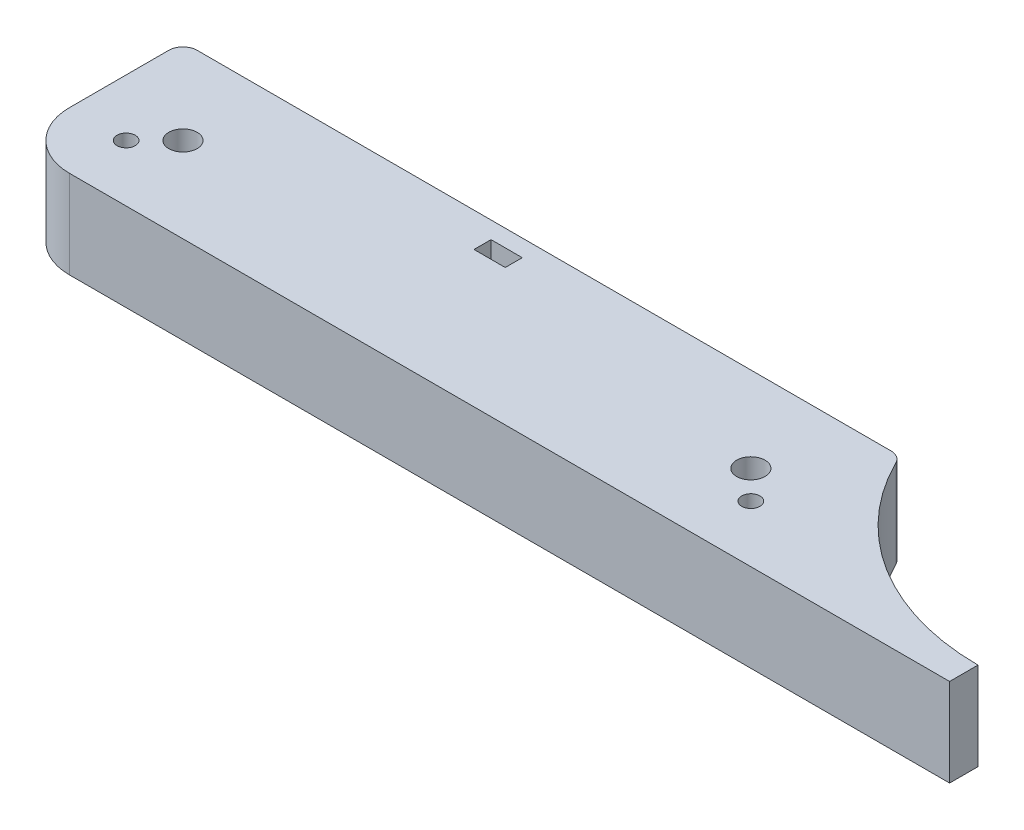
from build123d import *
from OCP.BRepFilletAPI import BRepFilletAPI_MakeChamfer, BRepFilletAPI_MakeFillet

# Parameters (mm, degrees)
BOSS_EXTRU_1_DEPTH      = 15.5
BOSS_EXTRU_2_START      = -35
BOSS_EXTRU_2_DEPTH      = 30
CHANFREIN1_SIZE         = 3.2
CHANFREIN2_SIZE         = 1.2
CHANFREIN2_SIZE2        = 1.697056275
CONG_1_R1               = 10
CONG_1_R2               = 2.5
ENL_V_MAT_EXTRU_1_REACH = 174.399
ESQUISSE3_R             = 1.6
ESQUISSE4_R             = 2
ENL_V_MAT_EXTRU_2_DEPTH = 13
ESQUISSE9_R             = 2.5
ENL_V_MAT_EXTRU_7_DEPTH = 7
ENL_V_MAT_EXTRU_3_REACH = 174.399
ESQUISSE5_R             = 1.6
ESQUISSE6_R             = 2
ENL_V_MAT_EXTRU_4_DEPTH = 13
ESQUISSE10_R            = 2.5
ENL_V_MAT_EXTRU_8_DEPTH = 7
ESQUISSE7_R             = 1.6
ENL_V_MAT_EXTRU_5_DEPTH = 12
ENL_V_START             = -3
ENL_V_MAT_EXTRU_6_DEPTH = 3


with BuildPart() as part:
    # Esquisse1 → Boss.-Extru.1 (new body)
    with BuildSketch(Plane(origin=(0, 0, 0), x_dir=(1, 0, 0), z_dir=(0, 1, 0))):
        with BuildLine():
            ThreePointArc((0, -42.5), (-23.048861143, -35.707142143), (-38.729833462, -17.5))
            Line((-38.729833462, -17.5), (-165, -17.5))
            Line((-165, -17.5), (-165, -47.5))
            Line((-165, -47.5), (0, -47.5))
            Line((0, -47.5), (0, -42.5))
        make_face()
    extrude(amount=BOSS_EXTRU_1_DEPTH)

    # Esquisse11 → Boss.-Extru.2 (add)
    with BuildSketch(Plane.ZY.offset(165).offset(BOSS_EXTRU_2_START)):
        Polygon((17.5, 0), (14.4, 0), (14.4, 6), (16, 6), (16, 2), (17.5, 2), align=None)
    extrude(amount=-BOSS_EXTRU_2_DEPTH)

    # Chanfrein1
    # the kernel refuses this chamfer: 3.2 mm, written as the material it adds along each edge
    with BuildSketch(Plane(origin=(-100, 10.229385561, 17.5), x_dir=(0.9996219169112968, 0, 0.027495876610586226), z_dir=(0, -1, 0))) as chanfrein1_piece_1_section:
        Polygon((CHANFREIN1_SIZE * 0.999621916911, -CHANFREIN1_SIZE * 0.0274958766106), (-CHANFREIN1_SIZE * 0.0274958766106, -CHANFREIN1_SIZE * 0.999621916911), (0, 0), align=None)
    chanfrein1_piece_1 = extrude(amount=10.229385561, mode=Mode.PRIVATE)
    chanfrein1_piece_1 = split(chanfrein1_piece_1, bisect_by=Plane(origin=(-99.489179746, 2, 15.404286374), z_dir=(0, 1, 0)), keep=Keep.TOP, mode=Mode.PRIVATE)
    chanfrein1_piece_1 = split(chanfrein1_piece_1, bisect_by=Plane(origin=(-99.489179746, 4, 14.4), z_dir=(0, 0, 1)), keep=Keep.TOP, mode=Mode.PRIVATE)
    chanfrein1_piece_1 = split(chanfrein1_piece_1, bisect_by=Plane(origin=(-99.489179746, 6, 15.404286374), z_dir=(0, -1, 0)), keep=Keep.TOP, mode=Mode.PRIVATE)
    chanfrein1_piece_1 = split(chanfrein1_piece_1, bisect_by=Plane(origin=(-99.489179746, 4, 16), z_dir=(0, 0, -1)), keep=Keep.TOP, mode=Mode.PRIVATE)
    add(chanfrein1_piece_1)
    with BuildSketch(Plane(origin=(-100, 2, 17.5), x_dir=(0.9996219169112968, 0, 0.027495876610585147), z_dir=(0, -1, 0))) as chanfrein1_piece_2_section:
        Polygon((CHANFREIN1_SIZE * 0.999621916911, -CHANFREIN1_SIZE * 0.0274958766106), (-CHANFREIN1_SIZE * 0.0274958766106, -CHANFREIN1_SIZE * 0.999621916911), (0, 0), align=None)
    chanfrein1_piece_2 = extrude(amount=2, mode=Mode.PRIVATE)
    chanfrein1_piece_2 = split(chanfrein1_piece_2, bisect_by=Plane(origin=(-98.721329155, 1, 16), z_dir=(0, 0, 1)), keep=Keep.TOP, mode=Mode.PRIVATE)
    add(chanfrein1_piece_2)
    with BuildSketch(Plane(origin=(-100, 2, 17.5), x_dir=(0.9996219169112968, 0, 0.027495876610585147), z_dir=(0, -1, 0))) as chanfrein1_piece_3_section:
        Polygon((CHANFREIN1_SIZE * 0.999621916911, -CHANFREIN1_SIZE * 0.0274958766106), (-CHANFREIN1_SIZE * 0.0274958766106, -CHANFREIN1_SIZE * 0.999621916911), (0, 0), align=None)
    chanfrein1_piece_3 = extrude(amount=2, mode=Mode.PRIVATE)
    chanfrein1_piece_3 = split(chanfrein1_piece_3, bisect_by=Plane(origin=(-99.489179746, 1, 14.4), z_dir=(0, 0, 1)), keep=Keep.TOP, mode=Mode.PRIVATE)
    chanfrein1_piece_3 = split(chanfrein1_piece_3, bisect_by=Plane(origin=(-99.489179746, 1, 16), z_dir=(0, 0, -1)), keep=Keep.TOP, mode=Mode.PRIVATE)
    add(chanfrein1_piece_3)
    with BuildSketch(Plane(origin=(-130, 10.229385561, 17.5), x_dir=(-0.9996219169112966, 0, 0.02749587661058634), z_dir=(0, -1, 0))) as chanfrein1_piece_4_section:
        Polygon((CHANFREIN1_SIZE * 0.999621916911, CHANFREIN1_SIZE * 0.0274958766106), (-CHANFREIN1_SIZE * 0.0274958766106, CHANFREIN1_SIZE * 0.999621916911), (0, 0), align=None)
    chanfrein1_piece_4 = extrude(amount=10.229385561, mode=Mode.PRIVATE)
    chanfrein1_piece_4 = split(chanfrein1_piece_4, bisect_by=Plane(origin=(-130.510820254, 2, 15.404286374), z_dir=(0, 1, 0)), keep=Keep.TOP, mode=Mode.PRIVATE)
    chanfrein1_piece_4 = split(chanfrein1_piece_4, bisect_by=Plane(origin=(-130.510820254, 4, 14.4), z_dir=(0, 0, 1)), keep=Keep.TOP, mode=Mode.PRIVATE)
    chanfrein1_piece_4 = split(chanfrein1_piece_4, bisect_by=Plane(origin=(-130.510820254, 6, 15.404286374), z_dir=(0, -1, 0)), keep=Keep.TOP, mode=Mode.PRIVATE)
    chanfrein1_piece_4 = split(chanfrein1_piece_4, bisect_by=Plane(origin=(-130.510820254, 4, 16), z_dir=(0, 0, -1)), keep=Keep.TOP, mode=Mode.PRIVATE)
    add(chanfrein1_piece_4)
    with BuildSketch(Plane(origin=(-130, 2, 17.5), x_dir=(-0.9996219169112966, 0, 0.027495876610585262), z_dir=(0, -1, 0))) as chanfrein1_piece_5_section:
        Polygon((CHANFREIN1_SIZE * 0.999621916911, CHANFREIN1_SIZE * 0.0274958766106), (-CHANFREIN1_SIZE * 0.0274958766106, CHANFREIN1_SIZE * 0.999621916911), (0, 0), align=None)
    chanfrein1_piece_5 = extrude(amount=2, mode=Mode.PRIVATE)
    chanfrein1_piece_5 = split(chanfrein1_piece_5, bisect_by=Plane(origin=(-131.278670845, 1, 16), z_dir=(0, 0, 1)), keep=Keep.TOP, mode=Mode.PRIVATE)
    add(chanfrein1_piece_5)
    with BuildSketch(Plane(origin=(-130, 2, 17.5), x_dir=(-0.9996219169112966, 0, 0.027495876610585262), z_dir=(0, -1, 0))) as chanfrein1_piece_6_section:
        Polygon((CHANFREIN1_SIZE * 0.999621916911, CHANFREIN1_SIZE * 0.0274958766106), (-CHANFREIN1_SIZE * 0.0274958766106, CHANFREIN1_SIZE * 0.999621916911), (0, 0), align=None)
    chanfrein1_piece_6 = extrude(amount=2, mode=Mode.PRIVATE)
    chanfrein1_piece_6 = split(chanfrein1_piece_6, bisect_by=Plane(origin=(-130.510820254, 1, 14.4), z_dir=(0, 0, 1)), keep=Keep.TOP, mode=Mode.PRIVATE)
    chanfrein1_piece_6 = split(chanfrein1_piece_6, bisect_by=Plane(origin=(-130.510820254, 1, 16), z_dir=(0, 0, -1)), keep=Keep.TOP, mode=Mode.PRIVATE)
    add(chanfrein1_piece_6)

    # Chanfrein2: one chamfer whose edges measure the first distance from different faces: ONE call of the kernel's chamfer builder (chamfer() names one face for all edges)
    chanfrein2_edges_1 = [part.edges().sort_by_distance(p)[0] for p in [
        (-98.3, 4, 16),
    ]]
    chanfrein2_side_1 = [part.faces().sort_by_distance(p)[0] for p in [
        (-98.730952381, 2.523809524, 15.569047619),
    ]]
    chanfrein2_edges_2 = [part.edges().sort_by_distance(p)[0] for p in [
        (-131.7, 4, 16),
    ]]
    chanfrein2_side_2 = [part.faces().sort_by_distance(p)[0] for p in [
        (-131.269047619, 2.523809524, 15.569047619),
    ]]
    chanfrein2 = BRepFilletAPI_MakeChamfer(part.part.solid().wrapped)
    for e in chanfrein2_edges_1:
        chanfrein2.Add(CHANFREIN2_SIZE, CHANFREIN2_SIZE2, e.wrapped, chanfrein2_side_1[0].wrapped)  # the first distance lies on this face
    for e in chanfrein2_edges_2:
        chanfrein2.Add(CHANFREIN2_SIZE, CHANFREIN2_SIZE2, e.wrapped, chanfrein2_side_2[0].wrapped)  # the first distance lies on this face
    add(Compound.cast(chanfrein2.Shape()), mode=Mode.REPLACE)

    # Congé1: one fillet with a radius per group of edges: ONE call of the kernel's fillet builder (fillet() takes one radius for all edges)
    cong_1_edges_1 = [part.edges().sort_by_distance(p)[0] for p in [
        (-165, 7.75, 47.5),
    ]]
    cong_1_edges_2 = [part.edges().sort_by_distance(p)[0] for p in [
        (-165, 7.75, 17.5),
        (-38.729833462, 7.75, 17.5),
    ]]
    cong_1 = BRepFilletAPI_MakeFillet(part.part.solid().wrapped)
    for e in cong_1_edges_1:
        cong_1.Add(CONG_1_R1, e.wrapped)
    for e in cong_1_edges_2:
        cong_1.Add(CONG_1_R2, e.wrapped)
    add(Compound.cast(cong_1.Shape()), mode=Mode.REPLACE)

    # Esquisse3 → Enlèv. mat.-Extru.1 (cut, up to next)
    with BuildSketch(Plane(origin=(0, 15.5, 0), x_dir=(1, 0, 0), z_dir=(0, 1, 0)), mode=Mode.PRIVATE) as enl_v_mat_extru_1_sk1:
        with Locations(Location((-155, -37.5, 0), (0, 0, 270))):
            Circle(ESQUISSE3_R)
    enl_v_mat_extru_1_tool1 = extrude(enl_v_mat_extru_1_sk1.sketch, amount=-ENL_V_MAT_EXTRU_1_REACH, mode=Mode.PRIVATE) & part.part
    # Esquisse3 → Enlèv. mat.-Extru.1 (cut, up to next)
    with BuildSketch(Plane(origin=(0, 15.5, 0), x_dir=(1, 0, 0), z_dir=(0, 1, 0)), mode=Mode.PRIVATE) as enl_v_mat_extru_1_sk2:
        with Locations(Location((-45, -37.5, 0), (0, 0, 270))):
            Circle(ESQUISSE3_R)
    enl_v_mat_extru_1_tool2 = extrude(enl_v_mat_extru_1_sk2.sketch, amount=-ENL_V_MAT_EXTRU_1_REACH, mode=Mode.PRIVATE) & part.part
    add(enl_v_mat_extru_1_tool1.solids().sort_by_distance((-155, 15.5, 37.5))[0], mode=Mode.SUBTRACT)
    add(enl_v_mat_extru_1_tool2.solids().sort_by_distance((-45, 15.5, 37.5))[0], mode=Mode.SUBTRACT)

    # Esquisse4 → Enlèv. mat.-Extru.2 (cut)
    with BuildSketch(Plane.XZ):
        with Locations(Location((-155, 37.5, 0), (0, 0, 270))):
            Circle(ESQUISSE4_R)
        with Locations(Location((-45, 37.5, 0), (0, 0, 270))):
            Circle(ESQUISSE4_R)
    extrude(amount=-ENL_V_MAT_EXTRU_2_DEPTH, mode=Mode.SUBTRACT)

    # Esquisse9 → Enlèv. mat.-Extru.7 (cut)
    with BuildSketch(Plane.XZ):
        with Locations(Location((-155, 37.5, 0), (0, 0, 270))):
            Circle(ESQUISSE9_R)
        with Locations(Location((-45, 37.5, 0), (0, 0, 270))):
            Circle(ESQUISSE9_R)
    extrude(amount=-ENL_V_MAT_EXTRU_7_DEPTH, mode=Mode.SUBTRACT)

    # Esquisse5 → Enlèv. mat.-Extru.3 (cut, up to next)
    with BuildSketch(Plane.XZ, mode=Mode.PRIVATE) as enl_v_mat_extru_3_sk1:
        with Locations(Location((-150, 32.5, 0), (0, 0, 270))):
            Circle(ESQUISSE5_R)
    enl_v_mat_extru_3_tool1 = extrude(enl_v_mat_extru_3_sk1.sketch, amount=-ENL_V_MAT_EXTRU_3_REACH, mode=Mode.PRIVATE) & part.part
    # Esquisse5 → Enlèv. mat.-Extru.3 (cut, up to next)
    with BuildSketch(Plane.XZ, mode=Mode.PRIVATE) as enl_v_mat_extru_3_sk2:
        with Locations(Location((-50, 32.5, 0), (0, 0, 270))):
            Circle(ESQUISSE5_R)
    enl_v_mat_extru_3_tool2 = extrude(enl_v_mat_extru_3_sk2.sketch, amount=-ENL_V_MAT_EXTRU_3_REACH, mode=Mode.PRIVATE) & part.part
    add(enl_v_mat_extru_3_tool1.solids().sort_by_distance((-150, 0, 32.5))[0], mode=Mode.SUBTRACT)
    add(enl_v_mat_extru_3_tool2.solids().sort_by_distance((-50, 0, 32.5))[0], mode=Mode.SUBTRACT)

    # Esquisse6 → Enlèv. mat.-Extru.4 (cut)
    with BuildSketch(Plane(origin=(0, 15.5, 0), x_dir=(1, 0, 0), z_dir=(0, 1, 0))):
        with Locations(Location((-150, -32.5, 0), (0, 0, 270))):
            Circle(ESQUISSE6_R)
        with Locations(Location((-50, -32.5, 0), (0, 0, 270))):
            Circle(ESQUISSE6_R)
    extrude(amount=-ENL_V_MAT_EXTRU_4_DEPTH, mode=Mode.SUBTRACT)

    # Esquisse10 → Enlèv. mat.-Extru.8 (cut)
    with BuildSketch(Plane(origin=(0, 15.5, 0), x_dir=(1, 0, 0), z_dir=(0, 1, 0))):
        with Locations(Location((-50, -32.5, 0), (0, 0, 270))):
            Circle(ESQUISSE10_R)
        with Locations(Location((-150, -32.5, 0), (0, 0, 270))):
            Circle(ESQUISSE10_R)
    extrude(amount=-ENL_V_MAT_EXTRU_8_DEPTH, mode=Mode.SUBTRACT)

    # Esquisse7 → Enlèv. mat.-Extru.5 (cut)
    with BuildSketch(Plane(origin=(0, 0, 17.5), x_dir=(-1, 0, 0), z_dir=(0, 0, -1))):
        with Locations((105, 7)):
            Circle(ESQUISSE7_R)
    extrude(amount=-ENL_V_MAT_EXTRU_5_DEPTH, mode=Mode.SUBTRACT)

    # Esquisse8 → Enlèv. mat.-Extru.6 (cut)
    with BuildSketch(Plane(origin=(0, 0, 17.5), x_dir=(-1, 0, 0), z_dir=(0, 0, -1)).offset(ENL_V_START)):
        Polygon((102.25, 5.41228676), (105, 3.824573519), (107.75, 5.41228676), (107.75, 8.58771324), (102.25, 8.58771324), align=None)
        Polygon((102.25, 8.58771324), (107.75, 8.58771324), (105, 10.175426481), align=None)
        Polygon((105, 10.175426481), (107.75, 8.58771324), (107.75, 15.5), (102.25, 15.5), (102.25, 8.58771324), align=None)
    extrude(amount=-ENL_V_MAT_EXTRU_6_DEPTH, mode=Mode.SUBTRACT)


solid = part.part
